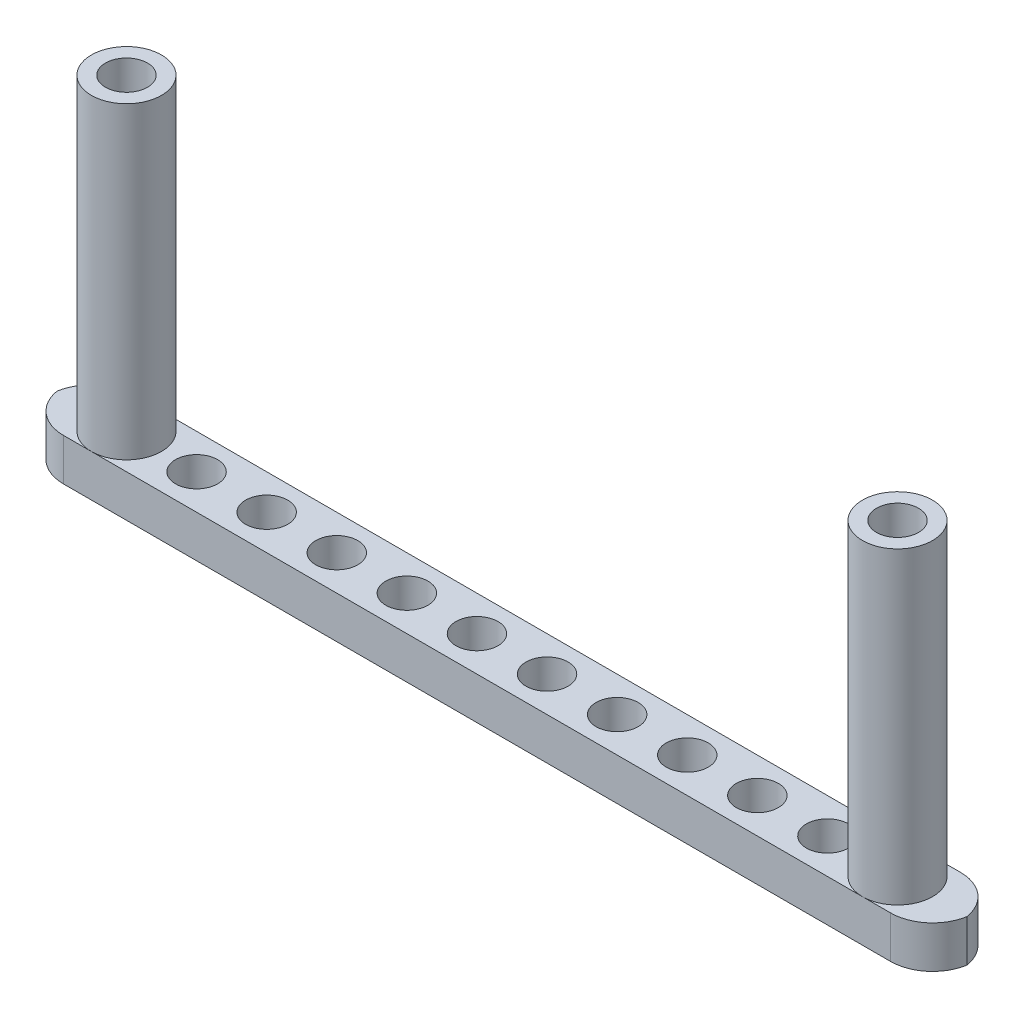
from build123d import *

# Parameters (mm, degrees)
SKETCH1_W           = 65
SKETCH1_H           = 5
SKETCH1_R           = 1.5
BOSS_EXTRUDE1_DEPTH = 3
SKETCH2_R           = 2.5
SKETCH2_R_2         = 1.5
BOSS_EXTRUDE2_DEPTH = 22
FILLET1_R           = 3


with BuildPart() as part:
    # Sketch1 → Boss-Extrude1 (new body)
    with BuildSketch(Plane(origin=(0, 0, 0), x_dir=(1, 0, 0), z_dir=(0, 1, 0))):
        with Locations((32.5, 2.5)):
            Rectangle(SKETCH1_W, SKETCH1_H)
        with Locations(Location((5, 2.5, 0), (0, 0, 270))):
            Circle(SKETCH1_R, mode=Mode.SUBTRACT)
        with Locations(Location((10, 2.5, 0), (0, 0, 270))):
            Circle(SKETCH1_R, mode=Mode.SUBTRACT)
        with Locations(Location((15, 2.5, 0), (0, 0, 270))):
            Circle(SKETCH1_R, mode=Mode.SUBTRACT)
        with Locations(Location((20, 2.5, 0), (0, 0, 270))):
            Circle(SKETCH1_R, mode=Mode.SUBTRACT)
        with Locations(Location((25, 2.5, 0), (0, 0, 270))):
            Circle(SKETCH1_R, mode=Mode.SUBTRACT)
        with Locations(Location((30, 2.5, 0), (0, 0, 270))):
            Circle(SKETCH1_R, mode=Mode.SUBTRACT)
        with Locations(Location((35, 2.5, 0), (0, 0, 270))):
            Circle(SKETCH1_R, mode=Mode.SUBTRACT)
        with Locations(Location((40, 2.5, 0), (0, 0, 270))):
            Circle(SKETCH1_R, mode=Mode.SUBTRACT)
        with Locations(Location((45, 2.5, 0), (0, 0, 270))):
            Circle(SKETCH1_R, mode=Mode.SUBTRACT)
        with Locations(Location((50, 2.5, 0), (0, 0, 270))):
            Circle(SKETCH1_R, mode=Mode.SUBTRACT)
        with Locations(Location((55, 2.5, 0), (0, 0, 270))):
            Circle(SKETCH1_R, mode=Mode.SUBTRACT)
        with Locations(Location((60, 2.5, 0), (0, 0, 270))):
            Circle(SKETCH1_R, mode=Mode.SUBTRACT)
    extrude(amount=BOSS_EXTRUDE1_DEPTH)

    # Sketch2 → Boss-Extrude2 (add)
    # profile 1 of 2: a face of its own
    with BuildSketch(Plane(origin=(0, 3, 0), x_dir=(1, 0, 0), z_dir=(0, 1, 0))):
        with Locations(Location((5, 2.5, 0), (0, 0, 270))):
            Circle(SKETCH2_R)
        with Locations(Location((5, 2.5, 0), (0, 0, 270))):
            Circle(SKETCH2_R_2, mode=Mode.SUBTRACT)
    # profile 2 of 2: a face of its own
    with BuildSketch(Plane(origin=(0, 3, 0), x_dir=(1, 0, 0), z_dir=(0, 1, 0))):
        with Locations(Location((60, 2.5, 0), (0, 0, 270))):
            Circle(SKETCH2_R)
        with Locations(Location((60, 2.5, 0), (0, 0, 270))):
            Circle(SKETCH2_R_2, mode=Mode.SUBTRACT)
    extrude(amount=BOSS_EXTRUDE2_DEPTH)

    # Fillet1
    # the kernel refuses this fillet: 3 mm, written as the material it takes off along each edge
    with BuildSketch(Plane(origin=(65, -7.5, -5), x_dir=(-1, 0, 0), z_dir=(0, 1, 0)), Plane(origin=(0, -7.5, 0), x_dir=(1, 0, 0), z_dir=(0, 1, 0))) as fillet1_piece_1:
        with BuildLine():
            CenterArc((FILLET1_R, FILLET1_R), FILLET1_R, 180, 90)
            Line((0, FILLET1_R), (0, 0))
            Line((0, 0), (FILLET1_R, 0))
        make_face()
    extrude(amount=18, mode=Mode.SUBTRACT)
    with BuildSketch(Plane(origin=(65, -7.5, 0), x_dir=(-1, 0, 0), z_dir=(0, 1, 0)), Plane(origin=(0, -7.5, -5), x_dir=(1, 0, 0), z_dir=(0, 1, 0))) as fillet1_piece_2:
        with BuildLine():
            CenterArc((FILLET1_R, -FILLET1_R), FILLET1_R, 90, 90)
            Line((0, -FILLET1_R), (0, 0))
            Line((0, 0), (FILLET1_R, 0))
        make_face()
    extrude(amount=18, mode=Mode.SUBTRACT)


solid = part.part
